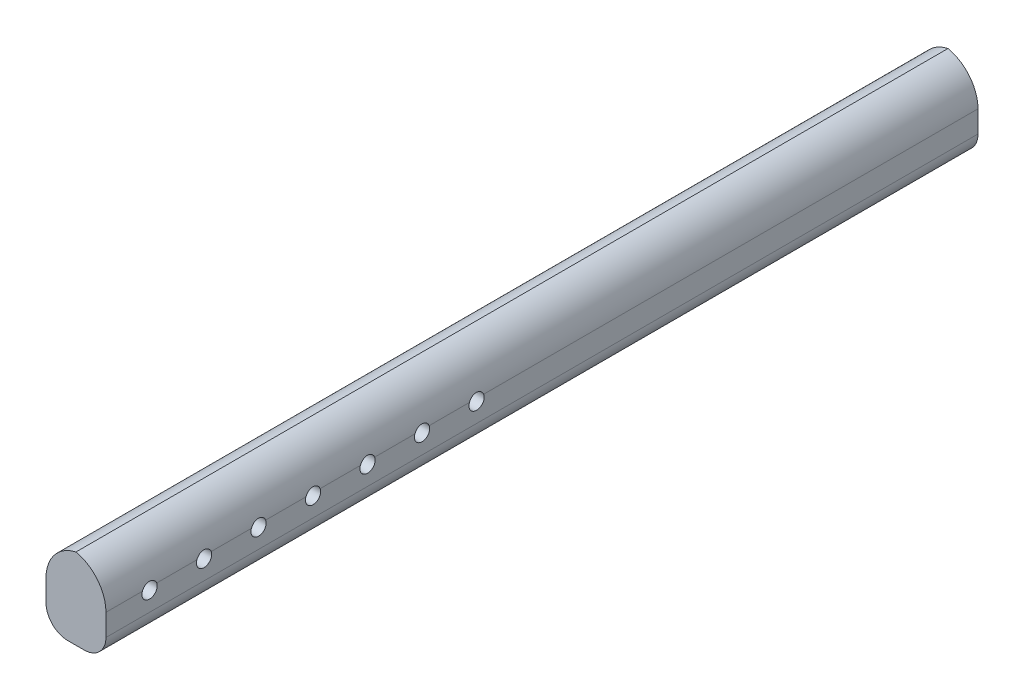
from build123d import *

# Parameters (mm, degrees)
ESQUISSE1_W             = 5.5
ESQUISSE1_H             = 7.5
BOSS_EXTRU_1_DEPTH      = 80
CONG_1_R                = 3.5
CONG_2_R                = 2
ESQUISSE2_R             = 0.7
ENL_V_MAT_EXTRU_1_DEPTH = 81.276475384


with BuildPart() as part:
    # Esquisse1 → Boss.-Extru.1 (new body)
    with BuildSketch(Plane.XY):
        Rectangle(ESQUISSE1_W, ESQUISSE1_H)
    extrude(amount=BOSS_EXTRU_1_DEPTH)

    # Congé1
    # the kernel refuses this fillet: 3.5 mm, written as the material it takes off along each edge
    with BuildSketch(Plane(origin=(-2.75, 3.75, -8.75), x_dir=(1, 0, 0), z_dir=(0, 0, 1))) as cong_1_piece_1:
        with BuildLine():
            CenterArc((CONG_1_R, -CONG_1_R), CONG_1_R, 90, 90)
            Line((0, -CONG_1_R), (0, 0))
            Line((0, 0), (CONG_1_R, 0))
        make_face()
    extrude(amount=97.5, mode=Mode.SUBTRACT)
    with BuildSketch(Plane(origin=(2.75, 3.75, -8.75), x_dir=(-1, 0, 0), z_dir=(0, 0, 1))) as cong_1_piece_2:
        with BuildLine():
            CenterArc((CONG_1_R, CONG_1_R), CONG_1_R, 180, 90)
            Line((0, CONG_1_R), (0, 0))
            Line((0, 0), (CONG_1_R, 0))
        make_face()
    extrude(amount=97.5, mode=Mode.SUBTRACT)

    # Congé2
    cong_2_edges = [part.edges().sort_by_distance(p)[0] for p in [
        (2.75, -3.75, 40),
        (-2.75, -3.75, 40),
    ]]
    fillet(cong_2_edges, radius=CONG_2_R)

    # Esquisse2 → Enlèv. mat.-Extru.1 (cut, through all)
    with BuildSketch(Plane.ZY.offset(2.75)):
        with Locations(Location((46, 0, 0), (0, 0, 159.075167572))):
            Circle(ESQUISSE2_R)
        with Locations(Location((51, 0, 0), (0, 0, 159.075167572))):
            Circle(ESQUISSE2_R)
        with Locations(Location((56, 0, 0), (0, 0, 159.075167572))):
            Circle(ESQUISSE2_R)
        with Locations(Location((61, 0, 0), (0, 0, 159.075167572))):
            Circle(ESQUISSE2_R)
        with Locations(Location((66, 0, 0), (0, 0, 159.075167572))):
            Circle(ESQUISSE2_R)
        with Locations(Location((71, 0, 0), (0, 0, 159.075167572))):
            Circle(ESQUISSE2_R)
        with Locations(Location((76, 0, 0), (0, 0, 159.075167572))):
            Circle(ESQUISSE2_R)
    extrude(amount=-ENL_V_MAT_EXTRU_1_DEPTH, mode=Mode.SUBTRACT)


solid = part.part
